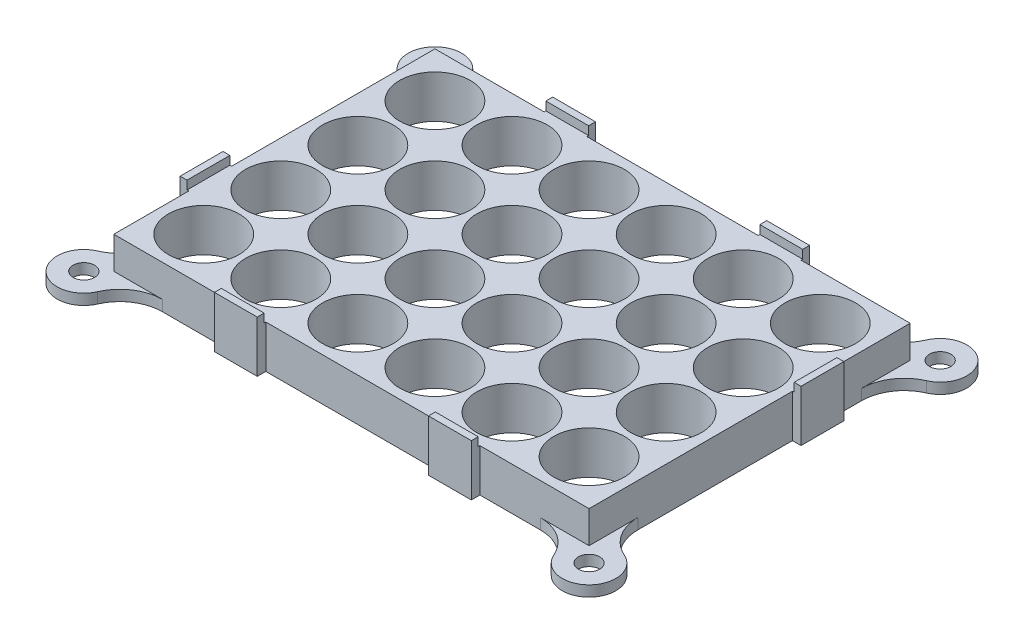
from build123d import *

# Parameters (mm, degrees)
SKETCH3_W              = 111
SKETCH3_H              = 75
SKETCH3_R              = 8.25
WELL_LIGHT_GUIDE_DEPTH = 10
SKETCH1_R              = 2.5
PCB_MOUNT_PLATE_DEPTH  = 2.5
SKETCH4_W              = 10
SKETCH4_H              = 2
SKETCH4_W_2            = 2
SKETCH4_H_2            = 10
TOP_GUIDE_TABS_DEPTH   = 12
SKETCH5_W              = 10
SKETCH5_H              = 0.4
SKETCH5_W_2            = 0.4
SKETCH5_H_2            = 10
F_3DPRINT_SPACER_DEPTH = 158.95766838
FILLET1_R              = 10


with BuildPart() as part:
    # Sketch3 → Well light guide (new body)
    with BuildSketch(Plane(origin=(0, 0, 0), x_dir=(1, 0, 0), z_dir=(0, 1, 0))):
        with Locations((64, 43)):
            Rectangle(SKETCH3_W, SKETCH3_H)
        with Locations(Location((19, 70, 0), (0, 0, 270))):
            Circle(SKETCH3_R, mode=Mode.SUBTRACT)
        with Locations(Location((37, 70, 0), (0, 0, 270))):
            Circle(SKETCH3_R, mode=Mode.SUBTRACT)
        with Locations(Location((55, 70, 0), (0, 0, 270))):
            Circle(SKETCH3_R, mode=Mode.SUBTRACT)
        with Locations(Location((73, 70, 0), (0, 0, 270))):
            Circle(SKETCH3_R, mode=Mode.SUBTRACT)
        with Locations(Location((91, 70, 0), (0, 0, 270))):
            Circle(SKETCH3_R, mode=Mode.SUBTRACT)
        with Locations(Location((109, 70, 0), (0, 0, 270))):
            Circle(SKETCH3_R, mode=Mode.SUBTRACT)
        with Locations(Location((37, 52, 0), (0, 0, 270))):
            Circle(SKETCH3_R, mode=Mode.SUBTRACT)
        with Locations(Location((55, 52, 0), (0, 0, 270))):
            Circle(SKETCH3_R, mode=Mode.SUBTRACT)
        with Locations(Location((73, 52, 0), (0, 0, 270))):
            Circle(SKETCH3_R, mode=Mode.SUBTRACT)
        with Locations(Location((91, 52, 0), (0, 0, 270))):
            Circle(SKETCH3_R, mode=Mode.SUBTRACT)
        with Locations(Location((109, 52, 0), (0, 0, 270))):
            Circle(SKETCH3_R, mode=Mode.SUBTRACT)
        with Locations(Location((37, 34, 0), (0, 0, 270))):
            Circle(SKETCH3_R, mode=Mode.SUBTRACT)
        with Locations(Location((55, 34, 0), (0, 0, 270))):
            Circle(SKETCH3_R, mode=Mode.SUBTRACT)
        with Locations(Location((73, 34, 0), (0, 0, 270))):
            Circle(SKETCH3_R, mode=Mode.SUBTRACT)
        with Locations(Location((91, 34, 0), (0, 0, 270))):
            Circle(SKETCH3_R, mode=Mode.SUBTRACT)
        with Locations(Location((109, 34, 0), (0, 0, 270))):
            Circle(SKETCH3_R, mode=Mode.SUBTRACT)
        with Locations(Location((37, 16, 0), (0, 0, 270))):
            Circle(SKETCH3_R, mode=Mode.SUBTRACT)
        with Locations(Location((55, 16, 0), (0, 0, 270))):
            Circle(SKETCH3_R, mode=Mode.SUBTRACT)
        with Locations(Location((73, 16, 0), (0, 0, 270))):
            Circle(SKETCH3_R, mode=Mode.SUBTRACT)
        with Locations(Location((91, 16, 0), (0, 0, 270))):
            Circle(SKETCH3_R, mode=Mode.SUBTRACT)
        with Locations(Location((109, 16, 0), (0, 0, 270))):
            Circle(SKETCH3_R, mode=Mode.SUBTRACT)
        with Locations(Location((19, 52, 0), (0, 0, 270))):
            Circle(SKETCH3_R, mode=Mode.SUBTRACT)
        with Locations(Location((19, 34, 0), (0, 0, 270))):
            Circle(SKETCH3_R, mode=Mode.SUBTRACT)
        with Locations(Location((19, 16, 0), (0, 0, 270))):
            Circle(SKETCH3_R, mode=Mode.SUBTRACT)
    extrude(amount=WELL_LIGHT_GUIDE_DEPTH)

    # Sketch1 → PCB mount plate (add)
    # profile 1 of 4: a face of its own
    with BuildSketch(Plane(origin=(0, 0, 0), x_dir=(1, 0, 0), z_dir=(0, 1, 0))):
        with BuildLine():
            Line((116.75, 84), (116.75, 80.5))
            Line((116.75, 80.5), (119.5, 80.5))
            Line((119.5, 80.5), (119.5, 77.75))
            Line((119.5, 77.75), (123, 77.75))
            ThreePointArc((123, 77.75), (127.419417382, 88.419417382), (116.75, 84))
        make_face()
        with Locations(Location((123, 84, 0), (0, 0, 270))):
            Circle(SKETCH1_R, mode=Mode.SUBTRACT)
    # profile 2 of 4: a face of its own
    with BuildSketch(Plane(origin=(0, 0, 0), x_dir=(1, 0, 0), z_dir=(0, 1, 0))):
        with BuildLine():
            Line((11.25, 84), (11.25, 80.5))
            Line((11.25, 80.5), (8.5, 80.5))
            Line((8.5, 80.5), (8.5, 77.75))
            Line((8.5, 77.75), (5, 77.75))
            ThreePointArc((5, 77.75), (0.580582618, 88.419417382), (11.25, 84))
        make_face()
        with Locations(Location((5, 84, 0), (0, 0, 90))):
            Circle(SKETCH1_R, mode=Mode.SUBTRACT)
    # profile 3 of 4: a face of its own
    with BuildSketch(Plane(origin=(0, 0, 0), x_dir=(1, 0, 0), z_dir=(0, 1, 0))):
        with BuildLine():
            Line((11.25, 2), (11.25, 5.5))
            Line((11.25, 5.5), (8.5, 5.5))
            Line((8.5, 5.5), (8.5, 8.25))
            Line((8.5, 8.25), (5, 8.25))
            ThreePointArc((5, 8.25), (0.580582618, -2.419417382), (11.25, 2))
        make_face()
        with Locations(Location((5, 2, 0), (0, 0, 270))):
            Circle(SKETCH1_R, mode=Mode.SUBTRACT)
    # profile 4 of 4: a face of its own
    with BuildSketch(Plane(origin=(0, 0, 0), x_dir=(1, 0, 0), z_dir=(0, 1, 0))):
        with BuildLine():
            Line((119.5, 5.5), (116.75, 5.5))
            Line((116.75, 5.5), (116.75, 2))
            ThreePointArc((116.75, 2), (127.419417382, -2.419417382), (123, 8.25))
            Line((123, 8.25), (119.5, 8.25))
            Line((119.5, 8.25), (119.5, 5.5))
        make_face()
        with Locations(Location((123, 2, 0), (0, 0, 90))):
            Circle(SKETCH1_R, mode=Mode.SUBTRACT)
    extrude(amount=PCB_MOUNT_PLATE_DEPTH)

    # Sketch4 → Top guide tabs (add)
    with BuildSketch(Plane.XZ):
        with Locations((39, -81.5)):
            Rectangle(SKETCH4_W, SKETCH4_H)
        with Locations((89, -4.5)):
            Rectangle(SKETCH4_W, SKETCH4_H)
        with Locations((7.5, -28)):
            Rectangle(SKETCH4_W_2, SKETCH4_H_2)
        with Locations((120.5, -58)):
            Rectangle(SKETCH4_W_2, SKETCH4_H_2)
        with Locations((39, -4.5)):
            Rectangle(SKETCH4_W, SKETCH4_H)
        with Locations((89, -81.5)):
            Rectangle(SKETCH4_W, SKETCH4_H)
    extrude(amount=-TOP_GUIDE_TABS_DEPTH)

    # Sketch5 → 3Dprint spacer (cut, through all)
    with BuildSketch(Plane(origin=(0, 10, 0), x_dir=(1, 0, 0), z_dir=(0, 1, 0))):
        with Locations((89, 80.7)):
            Rectangle(SKETCH5_W, SKETCH5_H)
        with Locations((89, 5.3)):
            Rectangle(SKETCH5_W, SKETCH5_H)
        with Locations((119.7, 58)):
            Rectangle(SKETCH5_W_2, SKETCH5_H_2)
        with Locations((39, 80.7)):
            Rectangle(SKETCH5_W, SKETCH5_H)
        with Locations((39, 5.3)):
            Rectangle(SKETCH5_W, SKETCH5_H)
        with Locations((8.3, 28)):
            Rectangle(SKETCH5_W_2, SKETCH5_H_2)
    extrude(amount=F_3DPRINT_SPACER_DEPTH, mode=Mode.SUBTRACT)

    # Fillet1
    # the kernel refuses this fillet: 10 mm, written as the material it adds along each edge
    with BuildSketch(Plane(origin=(116.75, 0, -80.5), x_dir=(0.0866364142554912, 0, -0.9962399970513885), z_dir=(0, 1, 0)), Plane(origin=(119.5, 0, -8.25), x_dir=(0.9962399970513889, 0, 0.08663641425548835), z_dir=(0, 1, 0)), Plane(origin=(8.5, 0, -77.75), x_dir=(-0.9962399970513889, 0, -0.08663641425548864), z_dir=(0, 1, 0))) as fillet1_piece_1:
        with BuildLine():
            CenterArc((9.213569299, 9.477236051), FILLET1_R, 184.970131688, 66.421821522)
            Line((-0.748830671, 8.610871908), (-1.745070668, 8.524235494))
            Line((-1.745070668, 8.524235494), (-0.996239997, -0.086636414))
            Line((-0.996239997, -0.086636414), (0.086636414, -0.996239997))
            ThreePointArc((0.086636414, -0.996239997), (3.573476404, -0.693012547), (5.70355275, -0.947723605))
            Line((5.70355275, -0.947723605), (6.022645164, 0))
        make_face()
    extrude(amount=2.5)
    with BuildSketch(Plane(origin=(119.5, 0, -77.75), x_dir=(0, 0, 1), z_dir=(0, 1, 0)), Plane(origin=(116.75, 0, -5.5), x_dir=(-1, 0, 0), z_dir=(0, 1, 0)), Plane(origin=(8.5, 0, -8.25), x_dir=(0, 0, -1), z_dir=(0, 1, 0)), Plane(origin=(11.25, 0, -80.5), x_dir=(1, 0, 0), z_dir=(0, 1, 0))) as fillet1_piece_2:
        with BuildLine():
            CenterArc((8.643371009, 10), FILLET1_R, 203.578178478, 66.421821522)
            Line((-0.521780381, 6), (-1.43829552, 5.6))
            ThreePointArc((-1.43829552, 5.6), (-1, 3.5), (-1, 0))
            Line((-1, 0), (0, -1))
            Line((0, -1), (8.643371009, -1))
            Line((8.643371009, -1), (8.643371009, 0))
        make_face()
    extrude(amount=2.5)
    with BuildSketch(Plane(origin=(11.25, 0, -5.5), x_dir=(1, 0, 0), z_dir=(0, 1, 0))) as fillet1_piece_3:
        with BuildLine():
            CenterArc((8.643371009, -10), FILLET1_R, 90, 66.421821522)
            Line((-0.521780381, -6), (-1.43829552, -5.6))
            ThreePointArc((-1.43829552, -5.6), (-1, -3.5), (-1, 0))
            Line((-1, 0), (0, 1))
            Line((0, 1), (8.643371009, 1))
            Line((8.643371009, 1), (8.643371009, 0))
        make_face()
    extrude(amount=2.5)


solid = part.part
